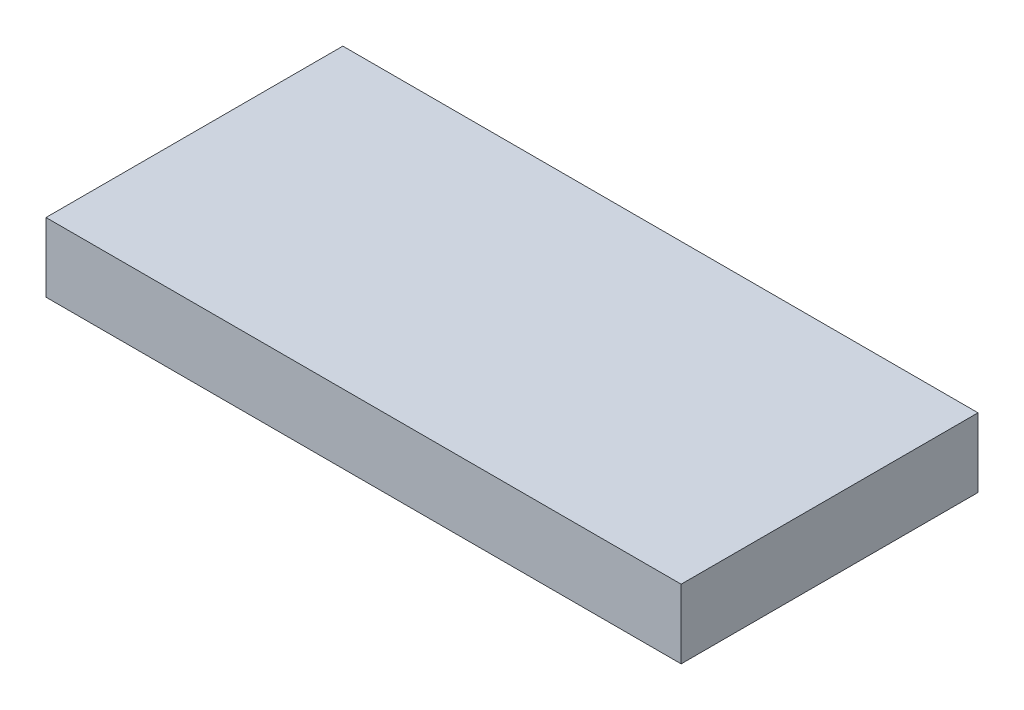
from build123d import *

# Parameters (mm, degrees)
SKETCH1_W                  = 184
SKETCH1_H                  = 86
BASE_DEPTH                 = 20
SKETCH2_R                  = 5.8
LOAD_CELL_BUTTON_CUT_DEPTH = 5.2


with BuildPart() as part:
    # Sketch1 → base (new body)
    with BuildSketch(Plane(origin=(0, 0, 0), x_dir=(1, 0, 0), z_dir=(0, 1, 0))):
        Rectangle(SKETCH1_W, SKETCH1_H)
    extrude(amount=BASE_DEPTH)

    # Sketch2 → load cell button cut (cut)
    with BuildSketch(Plane.XZ):
        Circle(SKETCH2_R)
    extrude(amount=-LOAD_CELL_BUTTON_CUT_DEPTH, mode=Mode.SUBTRACT)


solid = part.part
